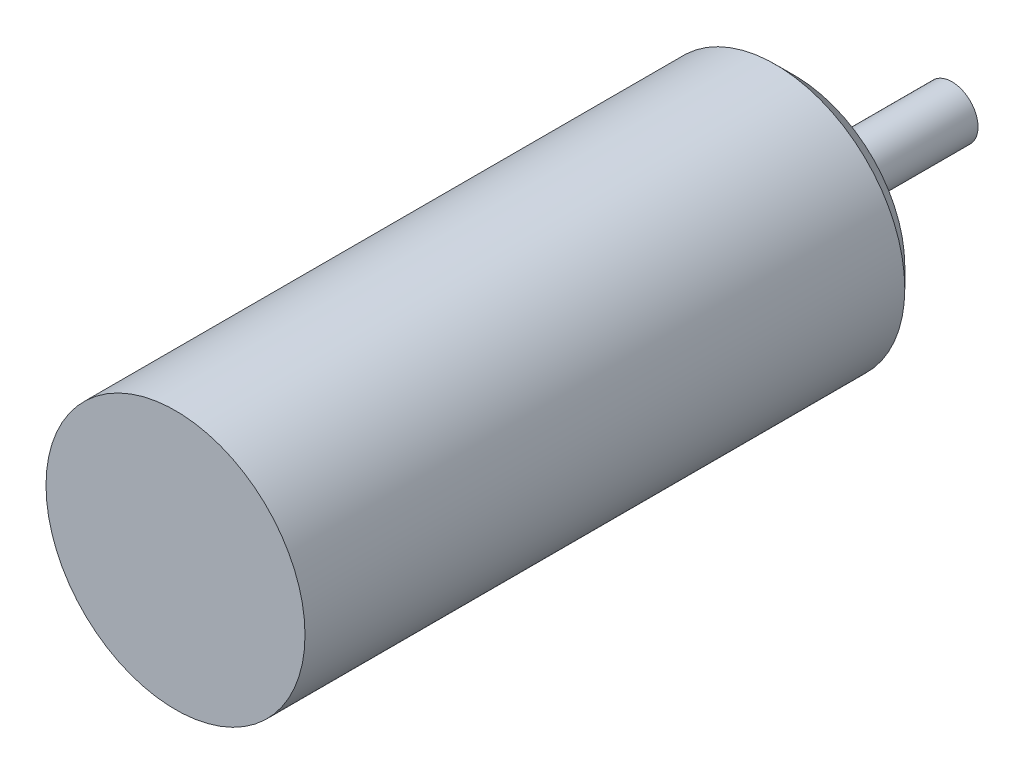
from build123d import *

# Parameters (mm, degrees)
SKETCH1_R                       = 19.8
BOSS_EXTRUDE1_DEPTH             = 94.7
M4X0_7_TAPPED_HOLE1_D           = 3.3
M4X0_7_TAPPED_HOLE1_DEPTH       = 4
M4X0_7_TAPPED_HOLE1_CSINK_D     = 4.05
M4X0_7_TAPPED_HOLE1_CSINK_ANGLE = 90
M4X0_7_TAPPED_HOLE1_TIP         = 0.991420021
SKETCH6_R                       = 4
BOSS_EXTRUDE2_DEPTH             = 24
CHAMFER1_SIZE                   = 3


with BuildPart() as part:
    # Sketch1 → Boss-Extrude1 (new body)
    with BuildSketch(Plane.XY):
        Circle(SKETCH1_R)
    extrude(amount=BOSS_EXTRUDE1_DEPTH)

    # M4x0.7 Tapped Hole1
    with Locations(Plane(origin=(0, 0, 0), x_dir=(-1, 0, 0), z_dir=(0, 0, -1))):
        with Locations((0, 12.5), (-12.5, 0), (0, -12.5), (12.5, 0)):
            CounterSinkHole(M4X0_7_TAPPED_HOLE1_D / 2, M4X0_7_TAPPED_HOLE1_CSINK_D / 2, depth=M4X0_7_TAPPED_HOLE1_DEPTH, counter_sink_angle=M4X0_7_TAPPED_HOLE1_CSINK_ANGLE)
            with Locations((0, 0, -(M4X0_7_TAPPED_HOLE1_DEPTH + M4X0_7_TAPPED_HOLE1_TIP / 2))):  # 118° drill point
                Cone(0, M4X0_7_TAPPED_HOLE1_D / 2, M4X0_7_TAPPED_HOLE1_TIP, mode=Mode.SUBTRACT)

    # Sketch6 → Boss-Extrude2 (add)
    with BuildSketch(Plane(origin=(0, 0, 0), x_dir=(-1, 0, 0), z_dir=(0, 0, -1))):
        Circle(SKETCH6_R)
    extrude(amount=BOSS_EXTRUDE2_DEPTH)

    # Chamfer1
    chamfer1_edges = [part.edges().sort_by_distance(p)[0] for p in [
        (-19.8, 0, 0),
    ]]
    chamfer(chamfer1_edges, length=CHAMFER1_SIZE)


solid = part.part
